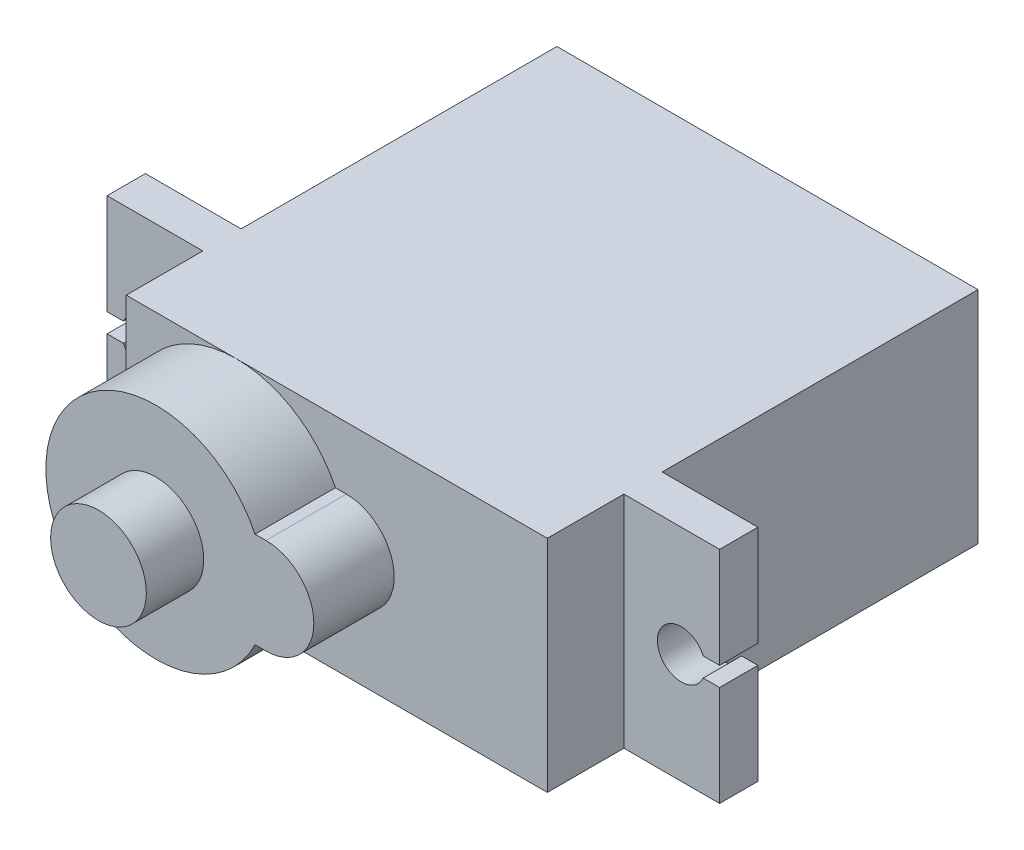
from build123d import *

# Parameters (mm, degrees)
ESQUISSE1_W             = 22
ESQUISSE1_H             = 11.5
BOSS_EXTRU_1_DEPTH      = 22.5
ESQUISSE2_W             = 32
ESQUISSE2_H             = 11.5
BOSS_EXTRU_2_DEPTH      = 2
ENL_V_MAT_EXTRU_1_DEPTH = 35.691497517
BOSS_EXTRU_3_DEPTH      = 4.2
ESQUISSE5_R             = 2.5
BOSS_EXTRU_4_DEPTH      = 3


with BuildPart() as part:
    # Esquisse1 → Boss.-Extru.1 (new body)
    with BuildSketch(Plane.XY):
        with Locations((-11, 5.75)):
            Rectangle(ESQUISSE1_W, ESQUISSE1_H)
    extrude(amount=BOSS_EXTRU_1_DEPTH)

    # Esquisse2 → Boss.-Extru.2 (add)
    with BuildSketch(Plane.XY.offset(18.5)):
        with Locations((-11, 5.75)):
            Rectangle(ESQUISSE2_W, ESQUISSE2_H)
    extrude(amount=-BOSS_EXTRU_2_DEPTH)

    # Esquisse3 → Enlèv. mat.-Extru.1 (cut, through all)
    with BuildSketch(Plane.XY.offset(18.5)):
        with BuildLine():
            Line((4.145643924, 6.25), (5, 6.25))
            Line((5, 6.25), (5, 5.25))
            Line((5, 5.25), (4.145643924, 5.25))
            ThreePointArc((4.145643924, 5.25), (1.75, 5.75), (4.145643924, 6.25))
        make_face()
        with BuildLine():
            Line((-26.145643924, 5.25), (-27, 5.25))
            Line((-27, 5.25), (-27, 6.25))
            Line((-27, 6.25), (-26.145643924, 6.25))
            ThreePointArc((-26.145643924, 6.25), (-23.75, 5.75), (-26.145643924, 5.25))
        make_face()
    extrude(amount=-ENL_V_MAT_EXTRU_1_DEPTH, mode=Mode.SUBTRACT)

    # Esquisse4 → Boss.-Extru.3 (add)
    with BuildSketch(Plane.XY.offset(22.5)):
        with BuildLine():
            Line((-10.5, 8.25), (-11.071921206, 8.25))
            ThreePointArc((-11.071921206, 8.25), (-22, 5.75), (-11.071921206, 3.25))
            Line((-11.071921206, 3.25), (-10.5, 3.25))
            ThreePointArc((-10.5, 3.25), (-8, 5.75), (-10.5, 8.25))
        make_face()
    extrude(amount=BOSS_EXTRU_3_DEPTH)

    # Esquisse5 → Boss.-Extru.4 (add)
    with BuildSketch(Plane.XY.offset(26.7)):
        with Locations((-16.25, 5.75)):
            Circle(ESQUISSE5_R)
    extrude(amount=BOSS_EXTRU_4_DEPTH)


solid = part.part
